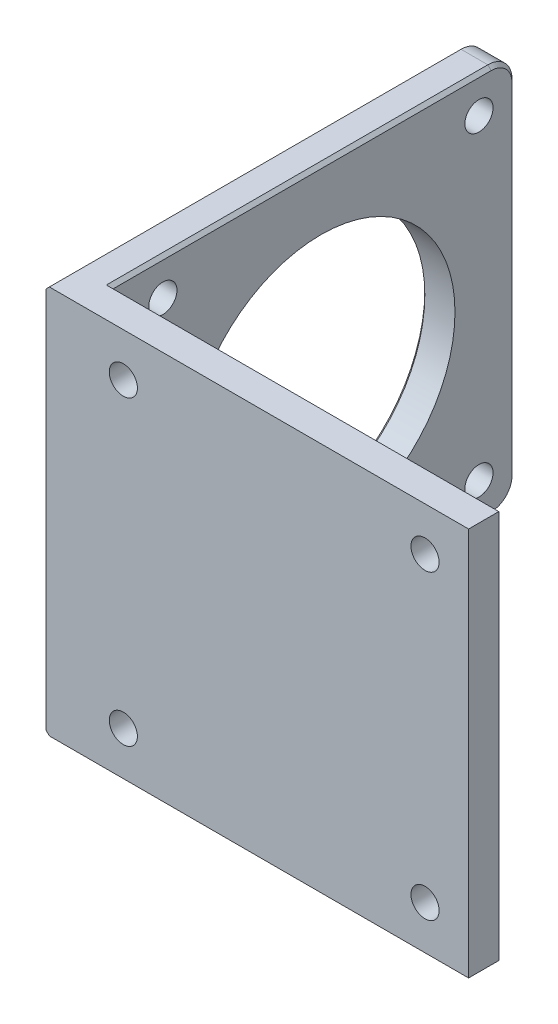
from build123d import *

# Parameters (mm, degrees)
BOSS_EXTRUDE2_DEPTH   = 58
SKETCH3_R             = 20
CUT_EXTRUDE3_DEPTH    = 105.673761331
M5X0_8_TAPPED_HOLE3_D = 4.2
M5X0_8_TAPPED_HOLE2_D = 4.2
FILLET1_R             = 3.6
CHAMFER1_SIZE         = 0.5


with BuildPart() as part:
    # Sketch2 → Boss-Extrude2 (new body)
    with BuildSketch(Plane(origin=(0, 0, 0), x_dir=(1, 0, 0), z_dir=(0, 1, 0))):
        Polygon((0, 0), (0, 65), (5, 65), (5, 5), (63.030994401, 5), (63.030994401, 0), align=None)
    extrude(amount=BOSS_EXTRUDE2_DEPTH)

    # Sketch3 → Cut-Extrude3 (cut, through all)
    with BuildSketch(Plane.ZY.offset(-5)):
        with Locations((-36, 29)):
            Circle(SKETCH3_R)
    extrude(amount=CUT_EXTRUDE3_DEPTH, mode=Mode.SUBTRACT)

    # M5x0.8 Tapped Hole3 (through all)
    with Locations(Plane.XY):
        with Locations((11.530994401, 6.5), (11.530994401, 51.5), (56.530994401, 51.5), (56.530994401, 6.5)):
            Hole(M5X0_8_TAPPED_HOLE3_D / 2)

    # M5x0.8 Tapped Hole2 (through all)
    with Locations(Plane.ZY):
        with Locations((-12.426827682, 5.426827682), (-12.426827682, 52.573172318), (-59.573172318, 52.573172318), (-59.573172318, 5.426827682)):
            Hole(M5X0_8_TAPPED_HOLE2_D / 2)

    # Fillet1
    fillet1_edges = [part.edges().sort_by_distance(p)[0] for p in [
        (2.5, 58, -65),
        (2.5, 0, -65),
    ]]
    fillet(fillet1_edges, radius=FILLET1_R)

    # Chamfer1
    chamfer1_edges = [part.edges().sort_by_distance(p)[0] for p in [
        (0, 58, -30.7),
        (0, 56.945584412, -63.945584412),
        (0, 29, -65),
        (0, 1.054415588, -63.945584412),
        (0, 0, -30.7),
        (5, 58, -33.2),
        (5, 56.945584412, -63.945584412),
        (5, 29, -65),
        (5, 1.054415588, -63.945584412),
        (34.0154972, 58, -5),
        (63.030994401, 29, -5),
        (34.0154972, 0, -5),
        (5, 0, -33.2),
        (0, 29, -56),
    ]]
    chamfer(chamfer1_edges, length=CHAMFER1_SIZE)


solid = part.part
